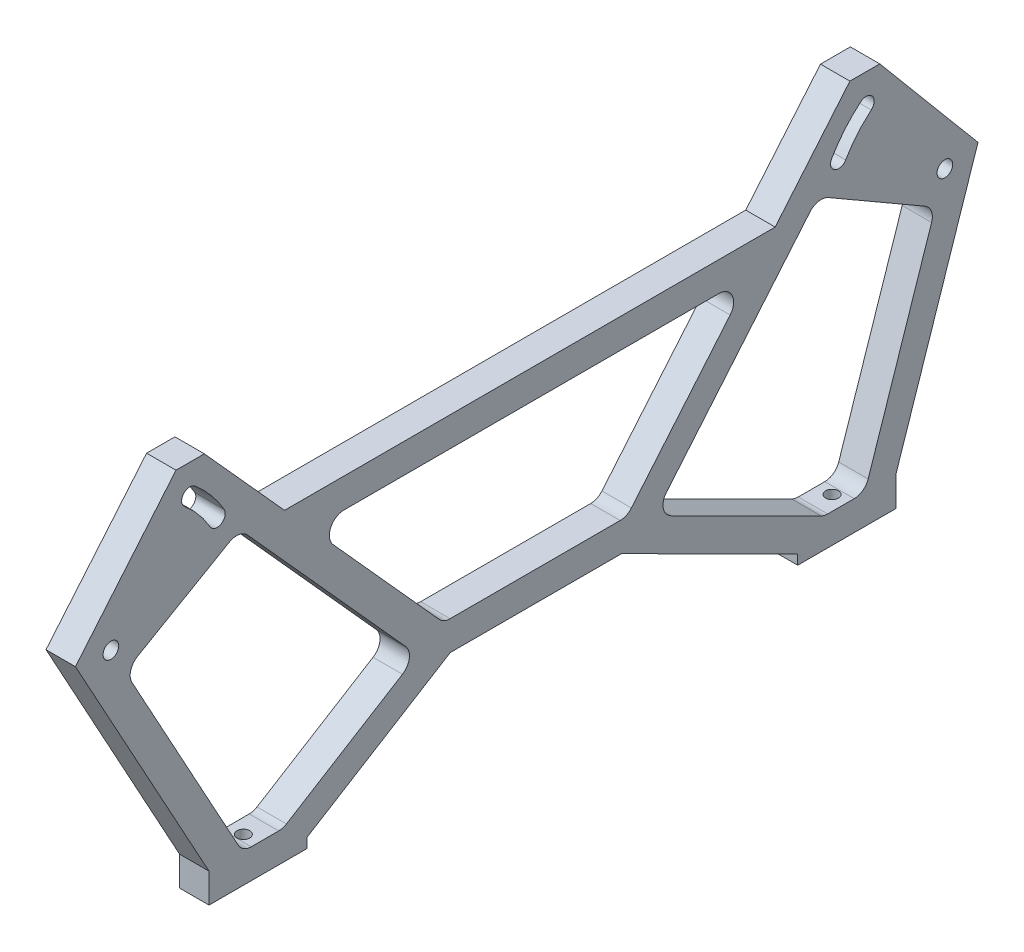
from build123d import *

# Parameters (mm, degrees)
SKETCH1_R           = 1.6
BOSS_EXTRUDE1_DEPTH = 6
FILLET1_R           = 3
CUT_EXTRUDE1_REACH  = 124.34
SKETCH2_R           = 1.3


with BuildPart() as part:
    # Sketch1 → Boss-Extrude1 (new body)
    with BuildSketch(Plane(origin=(0, 0, 0), x_dir=(0, 0, -1), z_dir=(1, 0, 0))):
        Polygon((-65, 0), (-45, 0), (-45, 2), (-15.828635098, 20), (19.080108807, 20), (55, 2), (55, 0), (75, 0), (75, 6), (91.752837084, 56.286625106), (71.728155707, 80.151111078), (65.63666206, 80.151111078), (50.406071449, 62), (-49.60870677, 62), (-65.952040593, 80.151111078), (-71.728155707, 80.151111078), (-92.232725383, 55.714716502), (-65, 6), align=None)
        with Locations((-85, 55)):
            Circle(SKETCH1_R, mode=Mode.SUBTRACT)
        with Locations((85, 55)):
            Circle(SKETCH1_R, mode=Mode.SUBTRACT)
        Polygon((-58.158781993, 6), (-49.943412455, 6), (-22.504576454, 22.930954368), (-58.774684177, 63.21298992), (-82.116733572, 49.736451418), align=None, mode=Mode.SUBTRACT)
        Polygon((-44.206282504, 56), (45.371473662, 56), (20.198484727, 26), (-17.194161175, 26), align=None, mode=Mode.SUBTRACT)
        Polygon((59.099147093, 63.025661168), (83.06422235, 49.189418517), (68.675798179, 6), (60.410331315, 6), (25.801463064, 23.343026602), align=None, mode=Mode.SUBTRACT)
        with BuildLine():
            ThreePointArc((-61.920422989, 68.325), (-64.584915591, 72.130289798), (-67.869710202, 75.415084409))
            ThreePointArc((-67.869710202, 75.415084409), (-70.194283089, 75.211710634), (-69.990909314, 72.887137747))
            ThreePointArc((-69.990909314, 72.887137747), (-67.112862253, 70.009090686), (-64.778306822, 66.675))
            ThreePointArc((-64.778306822, 66.675), (-62.524364905, 66.071058084), (-61.920422989, 68.325))
        make_face(mode=Mode.SUBTRACT)
        with BuildLine():
            ThreePointArc((67.869710202, 75.415084409), (64.584915591, 72.130289798), (61.920422989, 68.325))
            ThreePointArc((61.920422989, 68.325), (62.524364905, 66.071058084), (64.778306822, 66.675))
            ThreePointArc((64.778306822, 66.675), (67.112862253, 70.009090686), (69.990909314, 72.887137747))
            ThreePointArc((69.990909314, 72.887137747), (70.194283089, 75.211710634), (67.869710202, 75.415084409))
        make_face(mode=Mode.SUBTRACT)
    extrude(amount=BOSS_EXTRUDE1_DEPTH)

    # Fillet1
    fillet1_edges = [part.edges().sort_by_distance(p)[0] for p in [
        (3, 49.189418517, -83.06422235),
        (3, 63.025661168, -59.099147093),
        (3, 26, 17.194161175),
        (3, 26, -20.198484727),
        (3, 56, -45.371473662),
        (3, 56, 44.206282504),
        (3, 49.736451418, 82.116733572),
        (3, 63.21298992, 58.774684177),
        (3, 23.343026602, -25.801463064),
        (3, 6, -68.675798179),
        (3, 6, -60.410331315),
        (3, 6, 49.943412455),
        (3, 6, 58.158781993),
        (3, 22.930954368, 22.504576454),
    ]]
    fillet(fillet1_edges, radius=FILLET1_R)

    # Sketch2 → Cut-Extrude1 (cut, up to next)
    with BuildSketch(Plane.XZ, mode=Mode.PRIVATE) as cut_extrude1_sk1:
        with Locations((3, 55)):
            Circle(SKETCH2_R)
    cut_extrude1_tool1 = extrude(cut_extrude1_sk1.sketch, amount=-CUT_EXTRUDE1_REACH, mode=Mode.PRIVATE) & part.part
    # Sketch2 → Cut-Extrude1 (cut, up to next)
    with BuildSketch(Plane.XZ, mode=Mode.PRIVATE) as cut_extrude1_sk2:
        with Locations((3, -65)):
            Circle(SKETCH2_R)
    cut_extrude1_tool2 = extrude(cut_extrude1_sk2.sketch, amount=-CUT_EXTRUDE1_REACH, mode=Mode.PRIVATE) & part.part
    add(cut_extrude1_tool1.solids().sort_by_distance((3, 0, 55))[0], mode=Mode.SUBTRACT)
    add(cut_extrude1_tool2.solids().sort_by_distance((3, 0, -65))[0], mode=Mode.SUBTRACT)


solid = part.part
